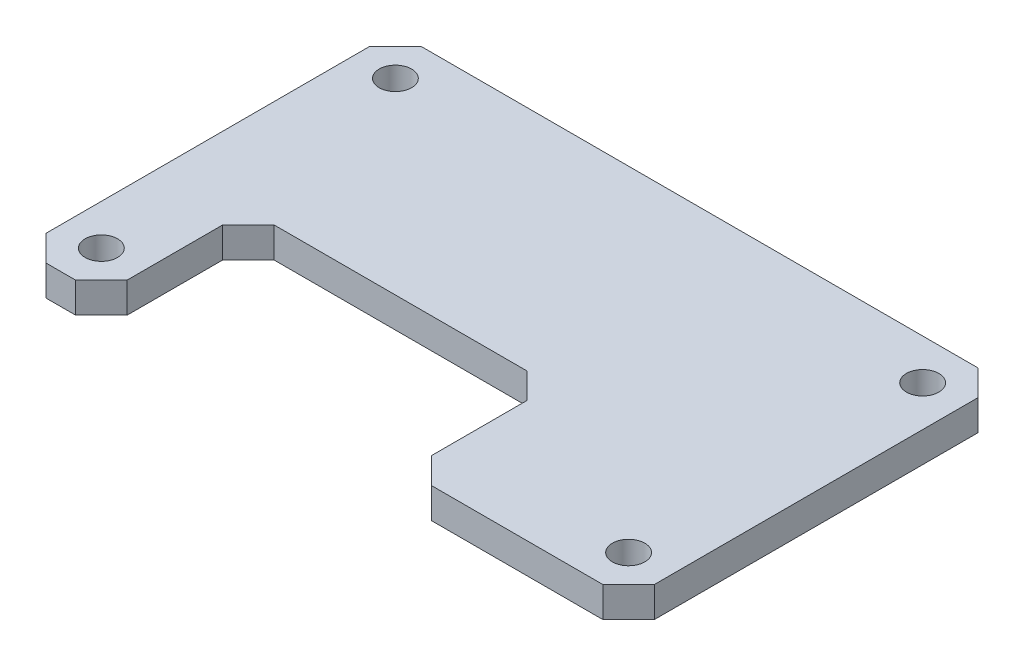
from build123d import *

# Parameters (mm, degrees)
SKETCH1_W           = 60
SKETCH1_H           = 37
BOSS_EXTRUDE1_DEPTH = 2.9972
SKETCH2_R           = 1.6
CUT_EXTRUDE1_DEPTH  = 36.372774952
SKETCH3_W           = 30
SKETCH3_H           = 14.5
CUT_EXTRUDE2_DEPTH  = 36.372774952
CHAMFER1_SIZE       = 2.54


with BuildPart() as part:
    # Sketch1 → Boss-Extrude1 (new body)
    with BuildSketch(Plane(origin=(0, 0, 0), x_dir=(1, 0, 0), z_dir=(0, 1, 0))):
        Rectangle(SKETCH1_W, SKETCH1_H)
    extrude(amount=BOSS_EXTRUDE1_DEPTH)

    # Sketch2 → Cut-Extrude1 (cut, through all)
    with BuildSketch(Plane(origin=(0, 2.9972, 0), x_dir=(1, 0, 0), z_dir=(0, 1, 0))):
        with Locations((-26, 14.5)):
            Circle(SKETCH2_R)
        with Locations((-26, -14.5)):
            Circle(SKETCH2_R)
        with Locations((26, -14.5)):
            Circle(SKETCH2_R)
        with Locations((26, 14.5)):
            Circle(SKETCH2_R)
    extrude(amount=-CUT_EXTRUDE1_DEPTH, mode=Mode.SUBTRACT)

    # Sketch3 → Cut-Extrude2 (cut, through all)
    with BuildSketch(Plane(origin=(0, 2.9972, 0), x_dir=(1, 0, 0), z_dir=(0, 1, 0))):
        with Locations((-7, -11.25)):
            Rectangle(SKETCH3_W, SKETCH3_H)
    extrude(amount=-CUT_EXTRUDE2_DEPTH, mode=Mode.SUBTRACT)

    # Chamfer1
    chamfer1_edges = [part.edges().sort_by_distance(p)[0] for p in [
        (-30, 1.4986, -18.5),
        (30, 1.4986, -18.5),
        (30, 1.4986, 18.5),
        (8, 1.4986, 18.5),
        (-30, 1.4986, 18.5),
        (-22, 1.4986, 18.5),
        (8, 1.4986, 4),
        (-22, 1.4986, 4),
    ]]
    chamfer(chamfer1_edges, length=CHAMFER1_SIZE)


solid = part.part
